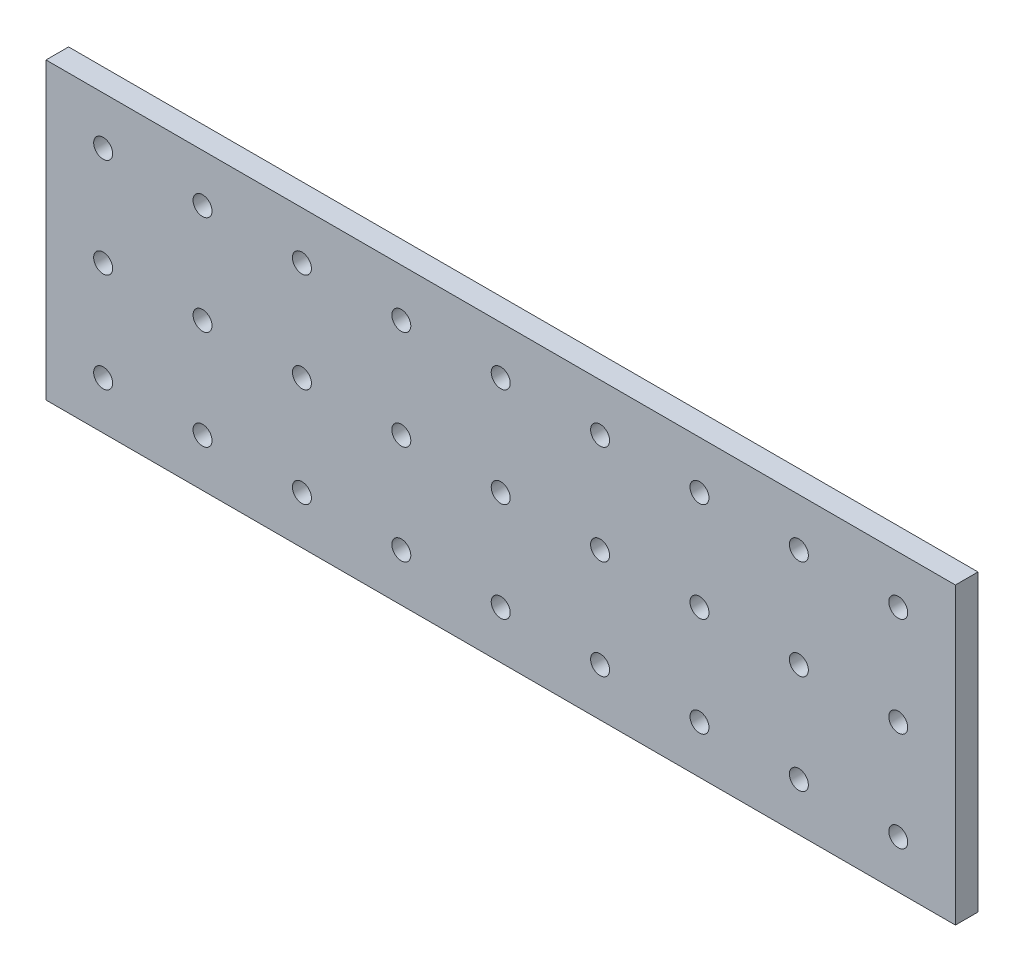
from build123d import *

# Parameters (mm, degrees)
ESBO_O1_W                = 201.3
ESBO_O1_H                = 65.2
RESSALTO_EXTRUS_O1_DEPTH = 5
ESBO_O2_R                = 2.1
CORTE_EXTRUS_O1_DEPTH    = 30


with BuildPart() as part:
    # Esboço1 → Ressalto-extrusão1 (new body)
    with BuildSketch(Plane.XY):
        with Locations((100.65, 32.6)):
            Rectangle(ESBO_O1_W, ESBO_O1_H)
    extrude(amount=RESSALTO_EXTRUS_O1_DEPTH)

    # Esboço2 → Corte-extrusão1 (cut)
    with BuildSketch(Plane.XY):
        with Locations((100.65, 32.6)):
            Circle(ESBO_O2_R)
        with Locations((100.65, 54.6)):
            Circle(ESBO_O2_R)
        with Locations((100.65, 10.6)):
            Circle(ESBO_O2_R)
        with Locations((122.65, 32.6)):
            Circle(ESBO_O2_R)
        with Locations((122.65, 54.6)):
            Circle(ESBO_O2_R)
        with Locations((122.65, 10.6)):
            Circle(ESBO_O2_R)
        with Locations((144.65, 32.6)):
            Circle(ESBO_O2_R)
        with Locations((144.65, 54.6)):
            Circle(ESBO_O2_R)
        with Locations((144.65, 10.6)):
            Circle(ESBO_O2_R)
        with Locations((166.65, 32.6)):
            Circle(ESBO_O2_R)
        with Locations((166.65, 54.6)):
            Circle(ESBO_O2_R)
        with Locations((166.65, 10.6)):
            Circle(ESBO_O2_R)
        with Locations((188.65, 32.6)):
            Circle(ESBO_O2_R)
        with Locations((188.65, 54.6)):
            Circle(ESBO_O2_R)
        with Locations((188.65, 10.6)):
            Circle(ESBO_O2_R)
        with Locations((78.65, 32.6)):
            Circle(ESBO_O2_R)
        with Locations((78.65, 54.6)):
            Circle(ESBO_O2_R)
        with Locations((78.65, 10.6)):
            Circle(ESBO_O2_R)
        with Locations((56.65, 32.6)):
            Circle(ESBO_O2_R)
        with Locations((56.65, 54.6)):
            Circle(ESBO_O2_R)
        with Locations((56.65, 10.6)):
            Circle(ESBO_O2_R)
        with Locations((34.65, 32.6)):
            Circle(ESBO_O2_R)
        with Locations((34.65, 54.6)):
            Circle(ESBO_O2_R)
        with Locations((34.65, 10.6)):
            Circle(ESBO_O2_R)
        with Locations((12.65, 32.6)):
            Circle(ESBO_O2_R)
        with Locations((12.65, 54.6)):
            Circle(ESBO_O2_R)
        with Locations((12.65, 10.6)):
            Circle(ESBO_O2_R)
    extrude(amount=CORTE_EXTRUS_O1_DEPTH, mode=Mode.SUBTRACT)


solid = part.part
